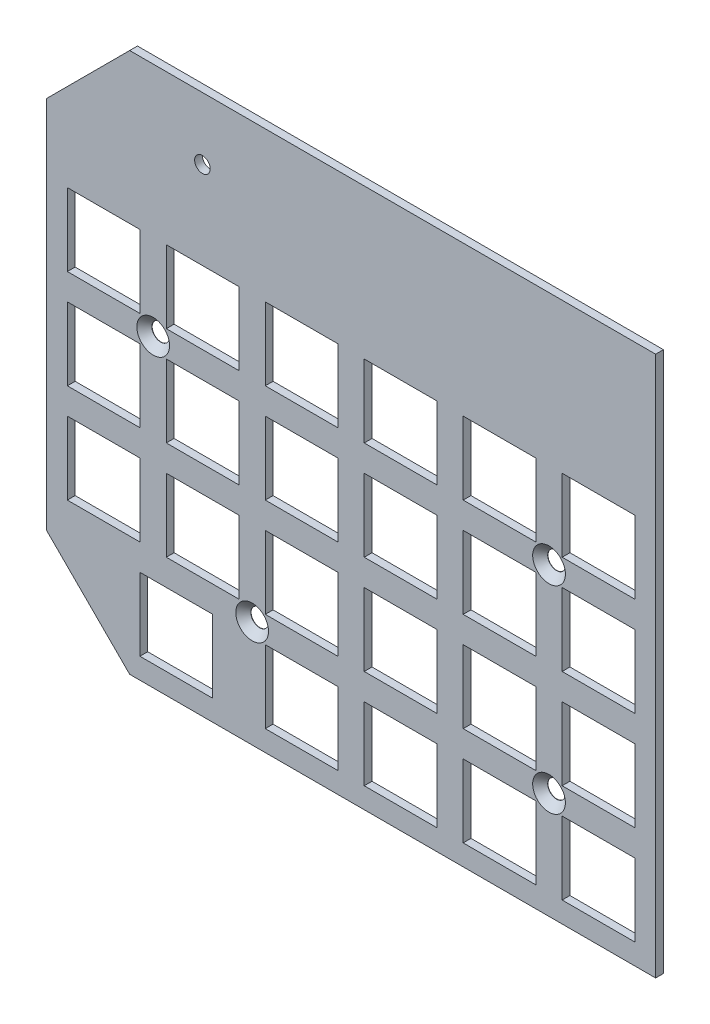
from build123d import *

# Parameters (mm, degrees)
BOSS_EXTRU_1_DEPTH                          = 1.5
ESQUISSE2_R                                 = 1.5
ESQUISSE2_W                                 = 14
ESQUISSE2_H                                 = 14
ENL_V_MAT_EXTRU_1_DEPTH                     = 1.5
FRAISAGE_POUR_VIS_T_TE_FRAIS_E_M31_AT_COUNT = 2
FRAISAGE_POUR_VIS_T_TE_FRAIS_E_M31_AT_PITCH = 76.2
FRAISAGE_POUR_VIS_T_TE_FRAIS_E_M31_2_COUNT  = 2
FRAISAGE_POUR_VIS_T_TE_FRAIS_E_M31_2_PITCH  = 85.194189943
FRAISAGE_POUR_VIS_T_TE_FRAIS_E_M31_3_COUNT  = 2
FRAISAGE_POUR_VIS_T_TE_FRAIS_E_M31_3_PITCH  = 42.597094971


with BuildPart() as part:
    # Esquisse1 → Boss.-Extru.1 (new body)
    with BuildSketch(Plane.XY):
        Polygon((0, -85), (16, -101), (117.25, -101), (117.25, 3), (16, 3), (0, -13), align=None)
    extrude(amount=BOSS_EXTRU_1_DEPTH)

    # Esquisse2 → Enlèv. mat.-Extru.1 (cut)
    with BuildSketch(Plane.XY.offset(1.5)):
        with Locations((30, -9)):
            Circle(ESQUISSE2_R)
        with Locations((11, -32.85)):
            Rectangle(ESQUISSE2_W, ESQUISSE2_H)
        with Locations((30.05, -32.85)):
            Rectangle(ESQUISSE2_W, ESQUISSE2_H)
        with Locations((49.1, -32.85)):
            Rectangle(ESQUISSE2_W, ESQUISSE2_H)
        with Locations((68.15, -32.85)):
            Rectangle(ESQUISSE2_W, ESQUISSE2_H)
        with Locations((87.2, -32.85)):
            Rectangle(ESQUISSE2_W, ESQUISSE2_H)
        with Locations((106.25, -32.85)):
            Rectangle(ESQUISSE2_W, ESQUISSE2_H)
        with Locations((30.05, -51.9)):
            Rectangle(ESQUISSE2_W, ESQUISSE2_H)
        with Locations((49.1, -51.9)):
            Rectangle(ESQUISSE2_W, ESQUISSE2_H)
        with Locations((68.15, -51.9)):
            Rectangle(ESQUISSE2_W, ESQUISSE2_H)
        with Locations((87.2, -51.9)):
            Rectangle(ESQUISSE2_W, ESQUISSE2_H)
        with Locations((106.25, -51.9)):
            Rectangle(ESQUISSE2_W, ESQUISSE2_H)
        with Locations((30.05, -70.95)):
            Rectangle(ESQUISSE2_W, ESQUISSE2_H)
        with Locations((49.1, -70.95)):
            Rectangle(ESQUISSE2_W, ESQUISSE2_H)
        with Locations((68.15, -70.95)):
            Rectangle(ESQUISSE2_W, ESQUISSE2_H)
        with Locations((87.2, -70.95)):
            Rectangle(ESQUISSE2_W, ESQUISSE2_H)
        with Locations((106.25, -70.95)):
            Rectangle(ESQUISSE2_W, ESQUISSE2_H)
        with Locations((11, -51.9)):
            Rectangle(ESQUISSE2_W, ESQUISSE2_H)
        with Locations((11, -70.95)):
            Rectangle(ESQUISSE2_W, ESQUISSE2_H)
        with Locations((49.1, -90)):
            Rectangle(ESQUISSE2_W, ESQUISSE2_H)
        with Locations((68.15, -90)):
            Rectangle(ESQUISSE2_W, ESQUISSE2_H)
        with Locations((87.2, -90)):
            Rectangle(ESQUISSE2_W, ESQUISSE2_H)
        with Locations((106.25, -90)):
            Rectangle(ESQUISSE2_W, ESQUISSE2_H)
        with Locations((24.97, -90)):
            Rectangle(ESQUISSE2_W, ESQUISSE2_H)
    extrude(amount=-ENL_V_MAT_EXTRU_1_DEPTH, mode=Mode.SUBTRACT)

    # Esquisse18 → Fraisage pour vis à tête fraisée M31 (revolve, cut)
    with BuildSketch(Plane(origin=(20.525, -42.375, 1.5), x_dir=(0, -1, 0), z_dir=(1, 0, 0))):
        Polygon((0, 0), (0, 1.5), (1.7, 1.5), (1.7, 1.45), (3.15, 0), align=None)
    fraisage_pour_vis_t_te_frais_e_m31 = revolve(axis=Axis((20.525, -42.375, 7.85), (0, 0, -1)), mode=Mode.SUBTRACT)

    # Fraisage pour vis à tête fraisée M31 at: Fraisage pour vis à tête fraisée M31 ×2
    with Locations(*[(i * FRAISAGE_POUR_VIS_T_TE_FRAIS_E_M31_AT_PITCH, 0, 0) for i in range(1, FRAISAGE_POUR_VIS_T_TE_FRAIS_E_M31_AT_COUNT)]):
        add(fraisage_pour_vis_t_te_frais_e_m31, mode=Mode.SUBTRACT)

    # Fraisage pour vis _ t_te frais_e M31 2: Fraisage pour vis à tête fraisée M31 ×2
    with Locations(*[Vector(0.894427190999922, -0.4472135954999459, 0) * (i * FRAISAGE_POUR_VIS_T_TE_FRAIS_E_M31_2_PITCH) for i in range(1, FRAISAGE_POUR_VIS_T_TE_FRAIS_E_M31_2_COUNT)]):
        add(fraisage_pour_vis_t_te_frais_e_m31, mode=Mode.SUBTRACT)

    # Fraisage pour vis _ t_te frais_e M31 3: Fraisage pour vis à tête fraisée M31 ×2
    with Locations(*[Vector(0.4472135955000063, -0.8944271909998918, 0) * (i * FRAISAGE_POUR_VIS_T_TE_FRAIS_E_M31_3_PITCH) for i in range(1, FRAISAGE_POUR_VIS_T_TE_FRAIS_E_M31_3_COUNT)]):
        add(fraisage_pour_vis_t_te_frais_e_m31, mode=Mode.SUBTRACT)


solid = part.part
